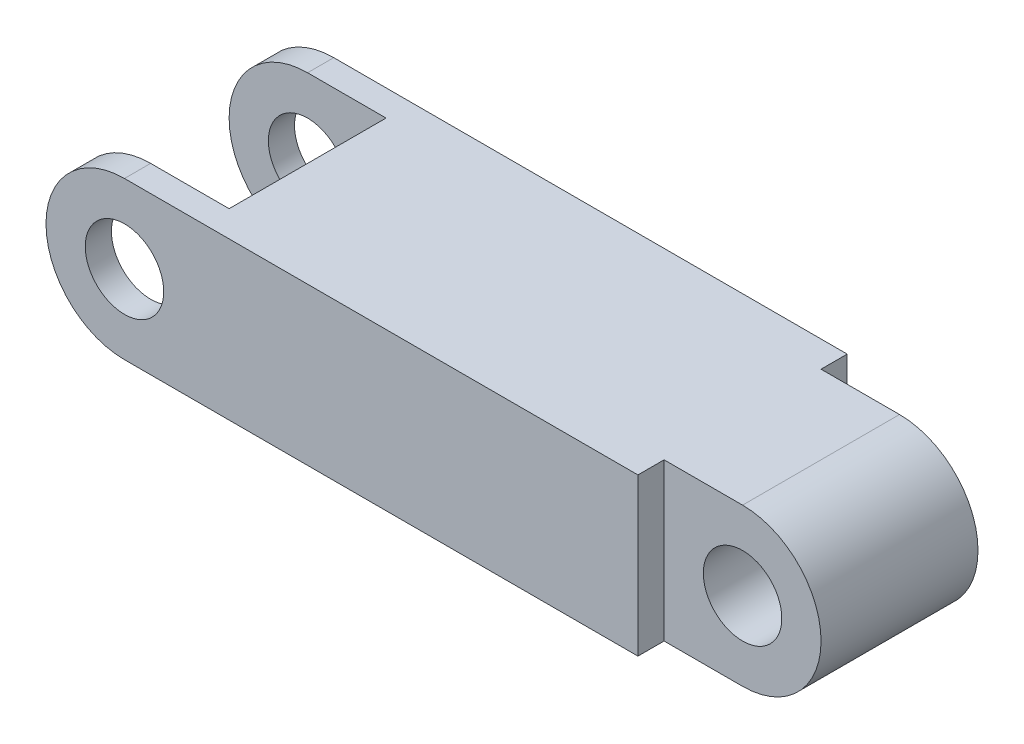
from build123d import *

# Parameters (mm, degrees)
SKETCH1_R           = 7.5
BOSS_EXTRUDE1_DEPTH = 40
SKETCH2_W           = 30
SKETCH2_H           = 30
SKETCH2_H_2         = 5
CUT_EXTRUDE1_DEPTH  = 138.549924397


with BuildPart() as part:
    # Sketch1 → Boss-Extrude1 (new body)
    with BuildSketch(Plane.XY):
        with BuildLine():
            Line((0, 15), (113.140476437, 15))
            ThreePointArc((113.140476437, 15), (128.140476437, 0), (113.140476437, -15))
            Line((113.140476437, -15), (0, -15))
            ThreePointArc((0, -15), (-15, 0), (0, 15))
        make_face()
        Circle(SKETCH1_R, mode=Mode.SUBTRACT)
        with Locations((113.140476437, 0)):
            Circle(SKETCH1_R, mode=Mode.SUBTRACT)
    extrude(amount=BOSS_EXTRUDE1_DEPTH)

    # Sketch2 → Cut-Extrude1 (cut, through all)
    with BuildSketch(Plane(origin=(0, 15, 0), x_dir=(1, 0, 0), z_dir=(0, 1, 0))):
        with Locations((0, -20)):
            Rectangle(SKETCH2_W, SKETCH2_H)
        with Locations((113.140476437, -2.5)):
            Rectangle(SKETCH2_W, SKETCH2_H_2)
        with Locations((113.140476437, -37.5)):
            Rectangle(SKETCH2_W, SKETCH2_H_2)
    extrude(amount=-CUT_EXTRUDE1_DEPTH, mode=Mode.SUBTRACT)


solid = part.part
